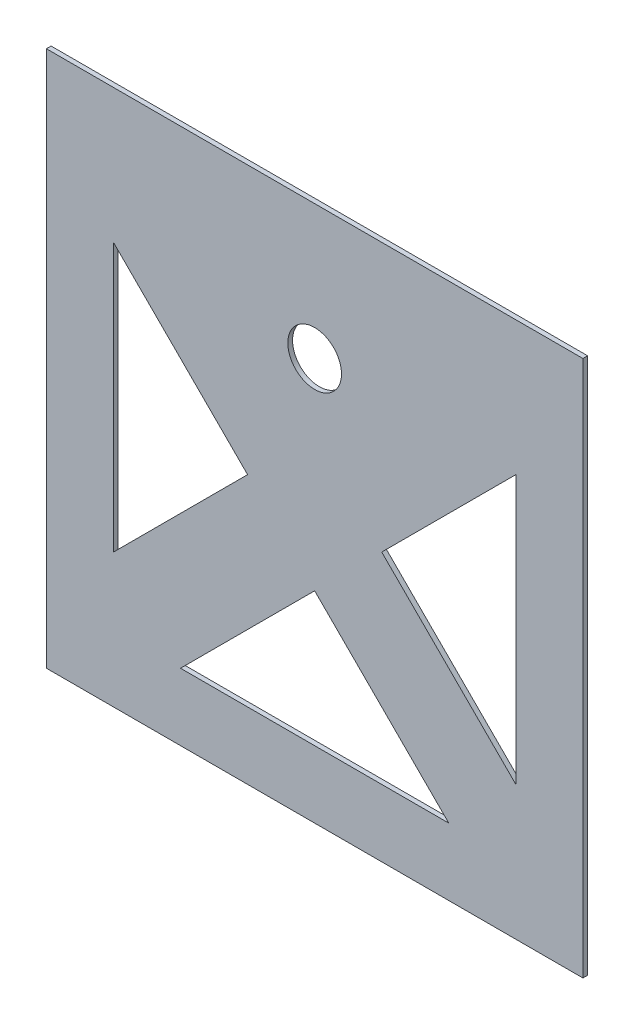
from build123d import *

# Parameters (mm, degrees)
SCHIZZO1_W                   = 800
SCHIZZO1_H                   = 800
ESTRUSIONE_ESTRUSIONE1_DEPTH = 7
SCHIZZO2_R                   = 40
TAGLIO_ESTRUSIONE1_DEPTH     = 15
TAGLIO_ESTRUSIONE2_DEPTH     = 566.728733582


with BuildPart() as part:
    # Schizzo1 → Estrusione-Estrusione1 (new body)
    with BuildSketch(Plane.XY):
        Rectangle(SCHIZZO1_W, SCHIZZO1_H)
    extrude(amount=ESTRUSIONE_ESTRUSIONE1_DEPTH)

    # Schizzo2 → Taglio-Estrusione1 (cut)
    with BuildSketch(Plane.XY.offset(7)):
        with Locations((0, 200)):
            Circle(SCHIZZO2_R)
    extrude(amount=-TAGLIO_ESTRUSIONE1_DEPTH, mode=Mode.SUBTRACT)

    # Schizzo3 → Taglio-Estrusione2 (cut, through all)
    with BuildSketch(Plane.XY.offset(7)):
        Polygon((-300, 200), (-300, -200), (-100, 0), align=None)
        Polygon((300, -200), (300, 200), (100, 0), align=None)
        Polygon((200, -300), (0, -100), (-200, -300), align=None)
    extrude(amount=-TAGLIO_ESTRUSIONE2_DEPTH, mode=Mode.SUBTRACT)


solid = part.part
